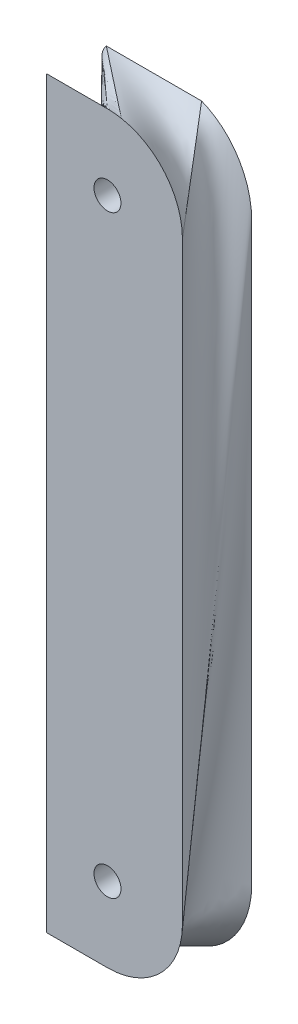
from build123d import *

# Parameters (mm, degrees)
M3_CLEARANCE_HOLE1_D = 3.6


with BuildPart() as part:
    # Loft1: read off the stored shape, not the designer's step
    # Loft1: loft between two sections, ruled curve by curve
    loft1_from = [
        Edge.make_bspline([(-6.687474411, -268.681032695, 0), (-7.74624179, -268.681032695, 0), (-9.863776548, -268.681032695, 0), (-13.040078685, -268.681032695, 0), (-16.216380823, -268.681032695, 0), (-18.333915581, -268.681032695, 0), (-19.39268296, -268.681032695, 0)], [0, 0, 0, 0, 0.25, 0.5, 0.75, 1, 1, 1, 1], 3),
        Edge.make_bspline([(-19.39268296, -268.681032695, 0), (-19.485212501, -268.780558181, 0), (-19.580411209, -268.91021833, 0), (-19.697971861, -269.092154856, 0), (-19.778081408, -269.25452142, 0), (-19.848981144, -269.41801038, 0), (-19.903465795, -269.587734558, 0), (-19.950383492, -269.762502691, 0), (-19.983926106, -269.976551862, 0), (-20, -270.136469689, 0), (-20, -278.015327198, 0), (-20, -293.686423742, 0), (-20, -317.489186132, 0), (-20, -341.291948522, 0), (-20, -356.963045065, 0), (-20, -364.706009094, 0)], [0, 0, 0, 0, 0.004238855, 0.00847771, 0.012716565, 0.01695542, 0.021194275, 0.02543313, 0.029671985, 0.03391084, 0.03391084, 0.27543313, 0.51695542, 0.75847771, 1, 1, 1, 1], 3),
        Edge.make_bspline([(-6.687474411, -366.297339568, 0), (-6.495447153, -366.222601506, 0), (-6.179861429, -366.089560087, 0), (-5.66620097, -365.83250925, 0), (-5.213052568, -365.576901459, 0), (-4.671208091, -365.228942886, 0), (-3.994770793, -364.721233134, 0), (-3.245173561, -364.035707112, 0), (-2.584104894, -363.297468787, 0), (-1.985577285, -362.495005677, 0), (-1.46594448, -361.645219253, 0), (-1.02047221, -360.751637804, 0), (-0.654358892, -359.823908881, 0), (-0.366903785, -358.868832512, 0), (-0.158616383, -357.888311771, 0), (-0.030020465, -356.880233516, 0), (0, -356.188529954, 0), (0, -354.316088145, 0), (0, -351.092978167, 0), (0, -345.794926351, 0), (0, -340.1134566, 0), (0, -334.128537828, 0), (0, -327.920138949, 0), (0, -321.685725806, 0), (0, -315.622764241, 0), (0, -309.928720097, 0), (0, -304.801059217, 0), (0, -300.165983794, 0), (0, -295.949696024, 0), (0, -292.0783981, 0), (0, -288.478292215, 0), (0, -285.687866326, 0), (0, -283.57152441, 0), (0, -282.039817718, 0), (0, -280.807645552, 0), (0, -279.847233039, 0), (0, -279.375264384, 0), (0, -278.907153559, 0), (-0.01109471, -278.564469211, 0), (-0.046860829, -278.016315803, 0), (-0.107950499, -277.485042392, 0), (-0.194381458, -276.94481587, 0), (-0.323500702, -276.315131688, 0), (-0.505013785, -275.631856214, 0), (-0.749177915, -274.909433714, 0), (-1.017662843, -274.251811708, 0), (-1.310167017, -273.641345054, 0), (-1.627586533, -273.066771704, 0), (-1.971536721, -272.520685214, 0), (-2.345015959, -271.997644645, 0), (-2.75147603, -271.4936577, 0), (-3.197505357, -271.005340114, 0), (-3.689666721, -270.530069151, 0), (-4.244017693, -270.064732231, 0), (-4.875138114, -269.606934733, 0), (-5.63580517, -269.150554024, 0), (-6.271662455, -268.84286899, 0), (-6.687474411, -268.681032695, 0)], [0, 0, 0, 0, 0.012941846, 0.019412769, 0.025883692, 0.032354615, 0.038825538, 0.045296461, 0.051767384, 0.058238306, 0.064709229, 0.071180152, 0.077651075, 0.084121998, 0.090592921, 0.097063844, 0.103534767, 0.103534767, 0.131539832, 0.159544896, 0.187549961, 0.215555025, 0.24356009, 0.271565155, 0.299570219, 0.327575284, 0.355580348, 0.383585413, 0.411590478, 0.439595542, 0.467600607, 0.495605671, 0.509608204, 0.523610736, 0.537613268, 0.544614534, 0.551615801, 0.551615801, 0.558621804, 0.565627807, 0.579639813, 0.593651819, 0.607663825, 0.635687838, 0.66371185, 0.691735863, 0.719759875, 0.747783888, 0.7758079, 0.803831913, 0.831855925, 0.859879938, 0.88790395, 0.915927963, 0.943951975, 0.971975988, 1, 1, 1, 1], 3),
        Edge.make_bspline([(-20, -364.706009094, 0), (-20, -364.85591921, 0), (-19.972610791, -365.152551319, 0), (-19.854049099, -365.575646742, 0), (-19.662699275, -365.964601053, 0), (-19.489733802, -366.192950936, 0), (-19.39268296, -366.297339568, 0)], [0, 0, 0, 0, 0.25, 0.5, 0.75, 1, 1, 1, 1], 3),
        Edge.make_bspline([(-19.39268296, -366.297339568, 0), (-6.687474411, -366.297339568, 0)], [0, 0, 1, 1], 1),
    ]
    loft1_to = [
        Edge.make_bspline([(-1.244046105, -277.869363222, 8), (-1.244046105, -276.667132913, 8), (-1.672484133, -274.347371685, 8), (-3.400884325, -271.362379901, 8), (-6.015456732, -269.112590064, 8), (-8.216239189, -268.263232732, 8), (-9.397802141, -268.041271687, 8)], [0, 0, 0, 0, 0.25, 0.5, 0.75, 1, 1, 1, 1], 3),
        Edge.make_bspline([(-9.397802141, -268.041271687, 8), (-9.411721182, -268.038656943, 8), (-9.401718328, -268.040007698, 8), (-9.637414287, -267.997919364, 8), (-10.006672893, -267.943211326, 8), (-10.314120553, -267.91222158, 8), (-10.634024924, -267.885042845, 8), (-10.992077328, -267.871316077, 8), (-11.24658206, -267.868580158, 8), (-11.229883599, -267.869363222, 8), (-12.051000092, -267.869363222, 8), (-13.431597283, -267.869363222, 8), (-15.327271725, -267.869363222, 8), (-17.222946167, -267.869363222, 8), (-18.603543358, -267.869363222, 8), (-19.410497344, -267.869363222, 8)], [0, 0, 0, 0, 0.004238855, 0.00847771, 0.012716565, 0.01695542, 0.021194275, 0.02543313, 0.029671985, 0.03391084, 0.03391084, 0.27543313, 0.51695542, 0.75847771, 1, 1, 1, 1], 3),
        Edge.make_bspline([(-19.410497344, -367.109009042, 8), (-18.727307537, -367.109009042, 8), (-17.818913602, -367.109009042, 8), (-16.798051031, -367.109009042, 8), (-16.116955719, -367.109009042, 8), (-15.509798973, -367.109009042, 8), (-14.965250159, -367.109009042, 8), (-14.471978643, -367.109009042, 8), (-14.018653795, -367.109009042, 8), (-13.593944981, -367.109009042, 8), (-13.195751015, -367.109009042, 8), (-12.82197071, -367.109009042, 8), (-12.470502882, -367.109009042, 8), (-12.139246343, -367.109009042, 8), (-11.825757322, -367.109009042, 8), (-11.527592045, -367.109009042, 8), (-11.337401841, -367.109009042, 8), (-10.840018208, -367.109009042, 8), (-10.109175817, -367.061815349, 8), (-9.143850056, -366.900947238, 8), (-8.270349017, -366.6699484, 8), (-7.465393144, -366.3802468, 8), (-6.716169978, -366.037489876, 8), (-6.013957405, -365.644735081, 8), (-5.353310324, -365.202740168, 8), (-4.730474607, -364.710625234, 8), (-4.143228706, -364.165606779, 8), (-3.590443216, -363.562830254, 8), (-3.072191847, -362.894260768, 8), (-2.589828238, -362.147364402, 8), (-2.146765308, -361.300686824, 8), (-1.815928482, -360.480419282, 8), (-1.581988169, -359.713480843, 8), (-1.426862263, -359.055138452, 8), (-1.320201579, -358.405521187, 8), (-1.260402017, -357.755037364, 8), (-1.244046105, -357.356184821, 8), (-1.244046105, -356.861666025, 8), (-1.244046105, -356.36294107, 8), (-1.244046105, -355.34864437, 8), (-1.244046105, -354.047889947, 8), (-1.244046105, -352.43022435, 8), (-1.244046105, -350.192127678, 8), (-1.244046105, -347.231873037, 8), (-1.244046105, -343.386180465, 8), (-1.244046105, -339.213927973, 8), (-1.244046105, -334.660827421, 8), (-1.244046105, -329.672590668, 8), (-1.244046105, -324.194929576, 8), (-1.244046105, -318.173556004, 8), (-1.244046105, -311.833747202, 8), (-1.244046105, -305.40078042, 8), (-1.244046105, -299.099932906, 8), (-1.244046105, -293.15648191, 8), (-1.244046105, -287.602235787, 8), (-1.244046105, -282.469002888, 8), (-1.244046105, -279.348728674, 8), (-1.244046105, -277.869363222, 8)], [0, 0, 0, 0, 0.012941846, 0.019412769, 0.025883692, 0.032354615, 0.038825538, 0.045296461, 0.051767384, 0.058238306, 0.064709229, 0.071180152, 0.077651075, 0.084121998, 0.090592921, 0.097063844, 0.103534767, 0.103534767, 0.131539832, 0.159544896, 0.187549961, 0.215555025, 0.24356009, 0.271565155, 0.299570219, 0.327575284, 0.355580348, 0.383585413, 0.411590478, 0.439595542, 0.467600607, 0.495605671, 0.509608204, 0.523610736, 0.537613268, 0.544614534, 0.551615801, 0.551615801, 0.558621804, 0.565627807, 0.579639813, 0.593651819, 0.607663825, 0.635687838, 0.66371185, 0.691735863, 0.719759875, 0.747783888, 0.7758079, 0.803831913, 0.831855925, 0.859879938, 0.88790395, 0.915927963, 0.943951975, 0.971975988, 1, 1, 1, 1], 3),
        Edge.make_bspline([(-19.410497344, -267.869363222, 8), (-19.410497344, -268.846987187, 8), (-19.410497344, -270.802235115, 8), (-19.410497344, -273.735107008, 8), (-19.410497344, -276.667978901, 8), (-19.410497344, -278.62322683, 8), (-19.410497344, -279.600850794, 8)], [0, 0, 0, 0, 0.25, 0.5, 0.75, 1, 1, 1, 1], 3),
        Edge.make_bspline([(-19.410497344, -279.600850794, 8), (-19.410497344, -367.109009042, 8)], [0, 0, 1, 1], 1),
    ]
    loft1 = Solid(Shell([*[Face.make_surface_from_curves(loft1_from[k], loft1_to[k]) for k in range(5)], Face(Wire(loft1_from)), Face(Wire(loft1_to))]))
    add(loft1)

    # M3 Clearance Hole1 (through all)
    with Locations(Plane.XY.offset(8)):
        with Locations((-11.244046105, -277.869363222), (-11.244046105, -357.109009042)):
            Hole(M3_CLEARANCE_HOLE1_D / 2)


solid = part.part
